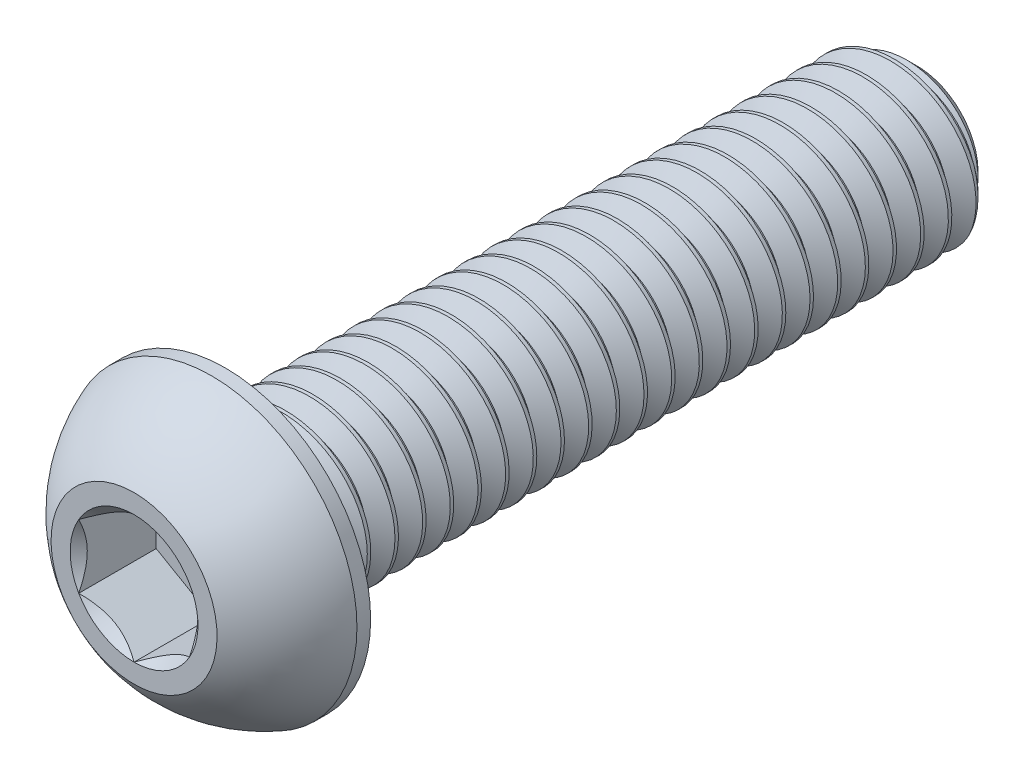
from build123d import *

# Parameters (mm, degrees)
CUT_EXTRUDE1_DEPTH = 2.8
CUT_SWEEP1_PITCH   = 1
CUT_SWEEP1_TO      = 25


with BuildPart() as part:
    # Sketch2 → Revolve1 (revolve)
    with BuildSketch(Plane(origin=(0, 0, 0), x_dir=(0, 0, -1), z_dir=(1, 0, 0)), mode=Mode.PRIVATE) as revolve1_sk:
        with BuildLine():
            Line((-14.15, 0), (14.15, 0))
            Line((14.15, 0), (14.15, 2.2))
            Line((14.15, 2.2), (13.35, 3))
            Line((13.35, 3), (-10.85, 3))
            Line((-10.85, 3), (-10.85, 5.25))
            Line((-10.85, 5.25), (-11.345, 5.25))
            ThreePointArc((-11.345, 5.25), (-12.933520981, 4.356906156), (-14.15, 3))
            Line((-14.15, 3), (-14.15, 0))
        make_face()
    revolve(revolve1_sk.sketch.rotate(Axis((0, 0, 14.15), (0, 0, -1)), 180), axis=Axis((0, 0, 14.15), (0, 0, -1)))

    # Sketch3 → Cut-Extrude1 (cut)
    with BuildSketch(Plane.XY.offset(14.15)):
        Polygon((0, 2.309401077), (-2, 1.154700538), (-2, -1.154700538), (0, -2.309401077), (2, -1.154700538), (2, 1.154700538), align=None)
    extrude(amount=-CUT_EXTRUDE1_DEPTH, mode=Mode.SUBTRACT)

    # Cut-Extrude2 cone 1 section (through the dimple's axis) → Cut-Extrude2 (revolve, cut)
    with BuildSketch(Plane(origin=(0, 0, 14.15), x_dir=(0, -1, 0), z_dir=(1, 0, 0))):
        Polygon((0, 0), (2.309401077, 0), (0, 2.309401077), align=None)
    revolve(axis=Axis((0, 0, 14.15), (0, 0, -1)), mode=Mode.SUBTRACT)


with BuildPart() as body_2:
    # Split1: read off the stored shape, not the designer's step
    # Split1: the piece on the far side of the plane
    add(part.part)
    split(bisect_by=Plane.XY.offset(10.85), keep=Keep.BOTTOM)

    # Cut-Sweep1: arcs per turn and ends read off the stored shape
    # Cut-Sweep1: the profile of Sketch6 screwed along a right-hand helix through 26 turns, 8 arcs to a turn; built about Z, then put on its axis
    cut_sweep1_z = Axis((0, 0, 0), (0, 0, 1))
    cut_sweep1_corners = [(2.350480947, 0, -0.375), (2.350480947, 0, -0.5), (3.054126588, 0, -0.90625), (3.054126588, 0, 0.03125)]
    with BuildLine(mode=Mode.PRIVATE) as cut_sweep1_profile:
        Line(cut_sweep1_corners[0], cut_sweep1_corners[1])
        Line(cut_sweep1_corners[1], cut_sweep1_corners[2])
        Line(cut_sweep1_corners[2], cut_sweep1_corners[3])
        Line(cut_sweep1_corners[3], cut_sweep1_corners[0])
    cut_sweep1_cap = Face(cut_sweep1_profile.wire())
    cut_sweep1_turn_angles = [0, 22.5, 45, 67.5, 90, 112.5, 135, 157.5, 180, 202.5, 225, 247.5, 270, 292.5, 315, 337.5, 360]
    cut_sweep1_turn_weights = [1, 0.9238795325112867, 1, 0.9238795325112867, 1, 0.9238795325112867, 1, 0.9238795325112867, 1, 0.9238795325112867, 1, 0.9238795325112867, 1, 0.9238795325112867, 1, 0.9238795325112867, 1]
    cut_sweep1_turn_rails = [Edge.make_bspline([Vector(p[0], p[1], 0).rotate(cut_sweep1_z, cut_sweep1_turn_angles[k]) / cut_sweep1_turn_weights[k] + Vector(0, 0, p[2] + CUT_SWEEP1_PITCH * cut_sweep1_turn_angles[k] / 360) for k in range(17)], [0, 0, 0, 1, 1, 2, 2, 3, 3, 4, 4, 5, 5, 6, 6, 7, 7, 8, 8, 8], 2, cut_sweep1_turn_weights) for p in cut_sweep1_corners]
    cut_sweep1_turn_sides = [Face.make_surface_from_curves(cut_sweep1_turn_rails[p[0]], cut_sweep1_turn_rails[p[1]]) for p in [(0, 1), (1, 2), (2, 3), (3, 0)]]
    cut_sweep1 = Plane(origin=(0, 0, -14.15), x_dir=(0, 1, 0), z_dir=(0, 0, 1)) * split(Solid(Shell([*[p.moved(Location((0, 0, CUT_SWEEP1_PITCH * i))) for i in range(26) for p in cut_sweep1_turn_sides], cut_sweep1_cap, cut_sweep1_cap.rotate(cut_sweep1_z, 9360).moved(Location((0, 0, CUT_SWEEP1_PITCH * 9360 / 360)))])), bisect_by=Plane.XY.offset(CUT_SWEEP1_TO), keep=Keep.BOTTOM, mode=Mode.PRIVATE)
    add(cut_sweep1, mode=Mode.SUBTRACT)


with BuildPart() as part_1:
    add(part.part)

    # Split1
    split(bisect_by=Plane.XY.offset(10.85), keep=Keep.TOP)

    add(body_2.part)  # Boss-Extrude1 merges body 2
    # Boss-Extrude1: read off the stored shape, not the designer's step
    # Boss-Extrude1 outline → Boss-Extrude1 (revolve)
    with BuildSketch(Plane.XZ):
        Polygon((2.350478583, 10.85), (2.350478583, 9.724995905), (3, 10.85), align=None)
    revolve(axis=Axis((0, 0, 0), (0, 0, 1)))


solid = part_1.part
